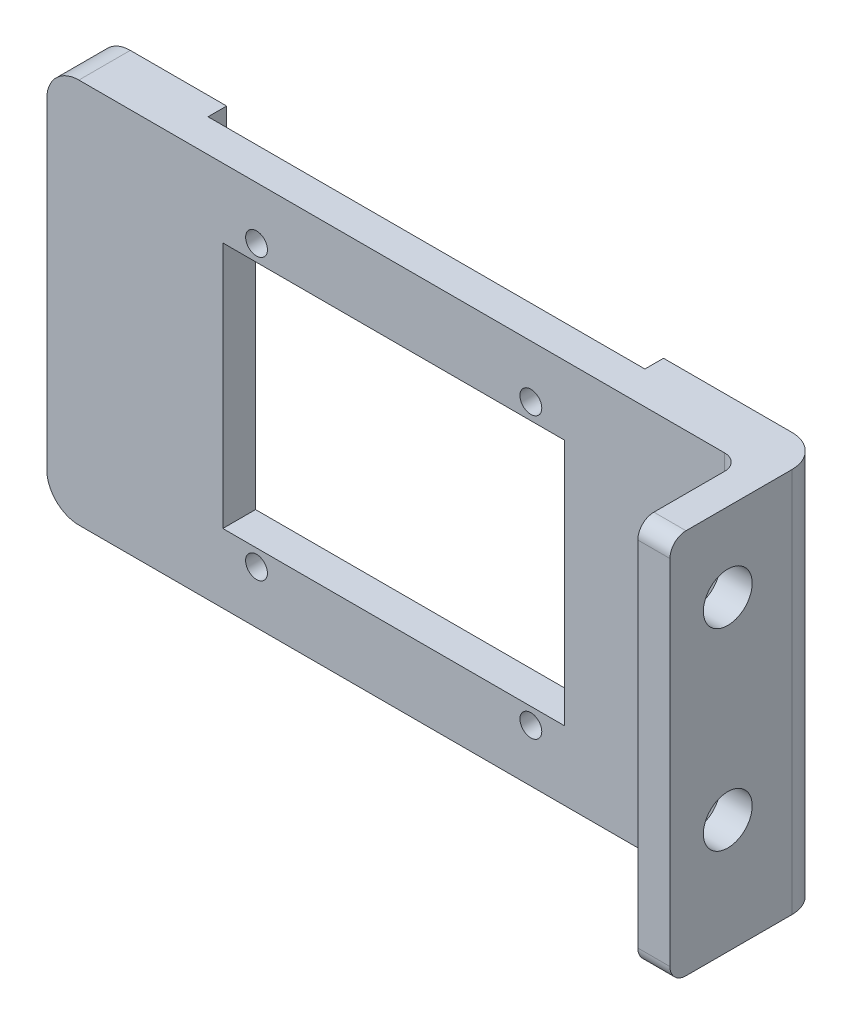
from build123d import *

# Parameters (mm, degrees)
BOSS_EXTRUDE1_DEPTH        = 30
FILLET3_R                  = 2.5
FILLET4_R                  = 1.25
F_3_8_3_8_DIAMETER_HOLE1_D = 3.8
FILLET5_R                  = 1.25
CUT_EXTRUDE1_REACH         = 38.376
SKETCH7_W                  = 26.6
SKETCH7_H                  = 19.25
CUT_EXTRUDE3_REACH         = 38.376
SKETCH8_R                  = 0.85


with BuildPart() as part:
    # Sketch2 → Boss-Extrude1 (new body)
    with BuildSketch(Plane(origin=(0, 11.515, 0), x_dir=(1, 0, 0), z_dir=(0, 1, 0))):
        Polygon((-27, 1.45), (-17, 1.45), (-17, 0), (17, 0), (17, 1.45), (29.5, 1.45), (29.5, -10.55), (27, -10.55), (27, -2.55), (-27, -2.55), align=None)
    extrude(amount=-BOSS_EXTRUDE1_DEPTH)

    # Fillet3
    fillet3_edges = [part.edges().sort_by_distance(p)[0] for p in [
        (29.5, -3.485, -1.45),
        (-27, 11.515, 0.55),
        (-27, -18.485, 0.55),
    ]]
    fillet(fillet3_edges, radius=FILLET3_R)

    # Fillet4
    fillet4_edges = [part.edges().sort_by_distance(p)[0] for p in [
        (27, -3.485, 2.55),
    ]]
    fillet(fillet4_edges, radius=FILLET4_R)

    # Ø3.8 (3.8) Diameter Hole1 (through all)
    with Locations(Plane(origin=(29.5, 0, 0), x_dir=(0, 0, -1), z_dir=(1, 0, 0))):
        with Locations((-6.05, -9.595), (-6.05, 5.405)):
            Hole(F_3_8_3_8_DIAMETER_HOLE1_D / 2)

    # Fillet5
    fillet5_edges = [part.edges().sort_by_distance(p)[0] for p in [
        (28.25, 11.515, 10.55),
        (28.25, -18.485, 10.55),
    ]]
    fillet(fillet5_edges, radius=FILLET5_R)

    # Sketch7 → Cut-Extrude1 (cut, up to next)
    with BuildSketch(Plane(origin=(0, 0, 0), x_dir=(-1, 0, 0), z_dir=(0, 0, -1)), mode=Mode.PRIVATE) as cut_extrude1_sk1:
        with Locations((0, -3.485)):
            Rectangle(SKETCH7_W, SKETCH7_H)
    cut_extrude1_tool1 = extrude(cut_extrude1_sk1.sketch, amount=-CUT_EXTRUDE1_REACH, mode=Mode.PRIVATE) & part.part
    add(cut_extrude1_tool1.solids().sort_by_distance((0, -3.485, 0))[0], mode=Mode.SUBTRACT)

    # Sketch8 → Cut-Extrude3 (cut, up to next)
    with BuildSketch(Plane(origin=(0, 0, 0), x_dir=(-1, 0, 0), z_dir=(0, 0, -1)), mode=Mode.PRIVATE) as cut_extrude3_sk1:
        with Locations((-10.675, 7.415)):
            Circle(SKETCH8_R)
    cut_extrude3_tool1 = extrude(cut_extrude3_sk1.sketch, amount=-CUT_EXTRUDE3_REACH, mode=Mode.PRIVATE) & part.part
    # Sketch8 → Cut-Extrude3 (cut, up to next)
    with BuildSketch(Plane(origin=(0, 0, 0), x_dir=(-1, 0, 0), z_dir=(0, 0, -1)), mode=Mode.PRIVATE) as cut_extrude3_sk2:
        with Locations((-10.675, -14.385)):
            Circle(SKETCH8_R)
    cut_extrude3_tool2 = extrude(cut_extrude3_sk2.sketch, amount=-CUT_EXTRUDE3_REACH, mode=Mode.PRIVATE) & part.part
    # Sketch8 → Cut-Extrude3 (cut, up to next)
    with BuildSketch(Plane(origin=(0, 0, 0), x_dir=(-1, 0, 0), z_dir=(0, 0, -1)), mode=Mode.PRIVATE) as cut_extrude3_sk3:
        with Locations((10.675, -14.385)):
            Circle(SKETCH8_R)
    cut_extrude3_tool3 = extrude(cut_extrude3_sk3.sketch, amount=-CUT_EXTRUDE3_REACH, mode=Mode.PRIVATE) & part.part
    # Sketch8 → Cut-Extrude3 (cut, up to next)
    with BuildSketch(Plane(origin=(0, 0, 0), x_dir=(-1, 0, 0), z_dir=(0, 0, -1)), mode=Mode.PRIVATE) as cut_extrude3_sk4:
        with Locations((10.675, 7.415)):
            Circle(SKETCH8_R)
    cut_extrude3_tool4 = extrude(cut_extrude3_sk4.sketch, amount=-CUT_EXTRUDE3_REACH, mode=Mode.PRIVATE) & part.part
    add(cut_extrude3_tool1.solids().sort_by_distance((10.675, 7.415, 0))[0], mode=Mode.SUBTRACT)
    add(cut_extrude3_tool2.solids().sort_by_distance((10.675, -14.385, 0))[0], mode=Mode.SUBTRACT)
    add(cut_extrude3_tool3.solids().sort_by_distance((-10.675, -14.385, 0))[0], mode=Mode.SUBTRACT)
    add(cut_extrude3_tool4.solids().sort_by_distance((-10.675, 7.415, 0))[0], mode=Mode.SUBTRACT)


solid = part.part
